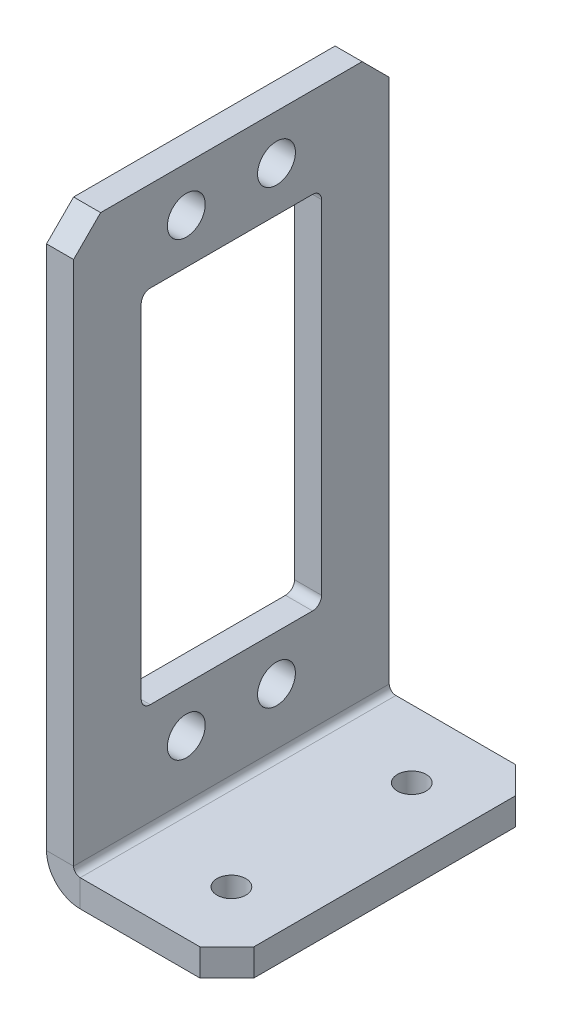
from build123d import *

# Parameters (mm, degrees)
SM_BASE_FLANGE_1_DEPTH      = 35
SKETCH_2_R                  = 1.6
CUT_EXTRUDE_1_DEPTH         = 74.952687578
PATTERN_LINEAR_1_COUNT      = 2
PATTERN_LINEAR_1_PITCH      = 20
CHAMFER_1_SIZE              = 3
SKETCH_3_R                  = 2.1
CUT_EXTRUDE_2_DEPTH         = 77.485292704
PATTERN_LINEAR_2_COUNT      = 2
PATTERN_LINEAR_2_PITCH      = 10
PATTERN_LINEAR_2_COUNT_DIR2 = 2
PATTERN_LINEAR_2_PITCH_DIR2 = 50
SKETCH_4_W                  = 20
SKETCH_4_H                  = 40
CUT_EXTRUDE_3_DEPTH         = 77.485292704
FILLET_1_R                  = 1


# Sheet-metal steps are written as plain solids
with BuildPart() as part:
    # Sketch 1 → 基材-凸緣1 (new body)
    with BuildSketch(Plane.XY):
        with BuildLine():
            Line((0, 65), (0, 3.7366))
            ThreePointArc((0, 3.7366), (1.094424801, 1.094424801), (3.7366, 0))
            Line((3.7366, 0), (20, 0))
            Line((20, 0), (20, 3))
            Line((20, 3), (3.7366, 3))
            ThreePointArc((3.7366, 3), (3.215745145, 3.215745145), (3, 3.7366))
            Line((3, 3.7366), (3, 65))
            Line((3, 65), (0, 65))
        make_face()
    extrude(amount=SM_BASE_FLANGE_1_DEPTH)

    # Sketch 2 → 除料-伸長1 (cut, through all)
    with BuildSketch(Plane(origin=(0, 3, 0), x_dir=(1, 0, 0), z_dir=(0, 1, 0))):
        with Locations(Location((13, -7.5, 0), (0, 0, 270))):
            Circle(SKETCH_2_R)
    cut_extrude_1 = extrude(amount=-CUT_EXTRUDE_1_DEPTH, mode=Mode.SUBTRACT)

    # 直線複製排列1: 除料-伸長1 ×2
    with Locations(*[(0, 0, i * PATTERN_LINEAR_1_PITCH) for i in range(1, PATTERN_LINEAR_1_COUNT)]):
        add(cut_extrude_1, mode=Mode.SUBTRACT)

    # 導角1
    chamfer_1_edges = [part.edges().sort_by_distance(p)[0] for p in [
        (20, 1.5, 35),
        (20, 1.5, 0),
        (1.5, 65, 35),
        (1.5, 65, 0),
    ]]
    chamfer(chamfer_1_edges, length=CHAMFER_1_SIZE)

    # 草圖3 → 除料-伸長2 (cut, through all)
    with BuildSketch(Plane.ZY):
        with Locations((12.5, 60)):
            Circle(SKETCH_3_R)
    cut_extrude_2 = extrude(amount=-CUT_EXTRUDE_2_DEPTH, mode=Mode.SUBTRACT)

    # 直線複製排列2: Cut-Extrude 2 2 × 2
    with Locations(*[(0, -j * PATTERN_LINEAR_2_PITCH_DIR2, i * PATTERN_LINEAR_2_PITCH) for i in range(PATTERN_LINEAR_2_COUNT) for j in range(PATTERN_LINEAR_2_COUNT_DIR2) if (i, j) != (0, 0)]):
        add(cut_extrude_2, mode=Mode.SUBTRACT)

    # 草圖4 → 除料-伸長3 (cut, through all)
    with BuildSketch(Plane.ZY):
        with Locations((17.5, 35)):
            Rectangle(SKETCH_4_W, SKETCH_4_H)
    extrude(amount=-CUT_EXTRUDE_3_DEPTH, mode=Mode.SUBTRACT)

    # 圓角1
    fillet_1_edges = [part.edges().sort_by_distance(p)[0] for p in [
        (1.5, 15, 7.5),
        (1.5, 55, 7.5),
        (1.5, 55, 27.5),
        (1.5, 15, 27.5),
    ]]
    fillet(fillet_1_edges, radius=FILLET_1_R)


solid = part.part
